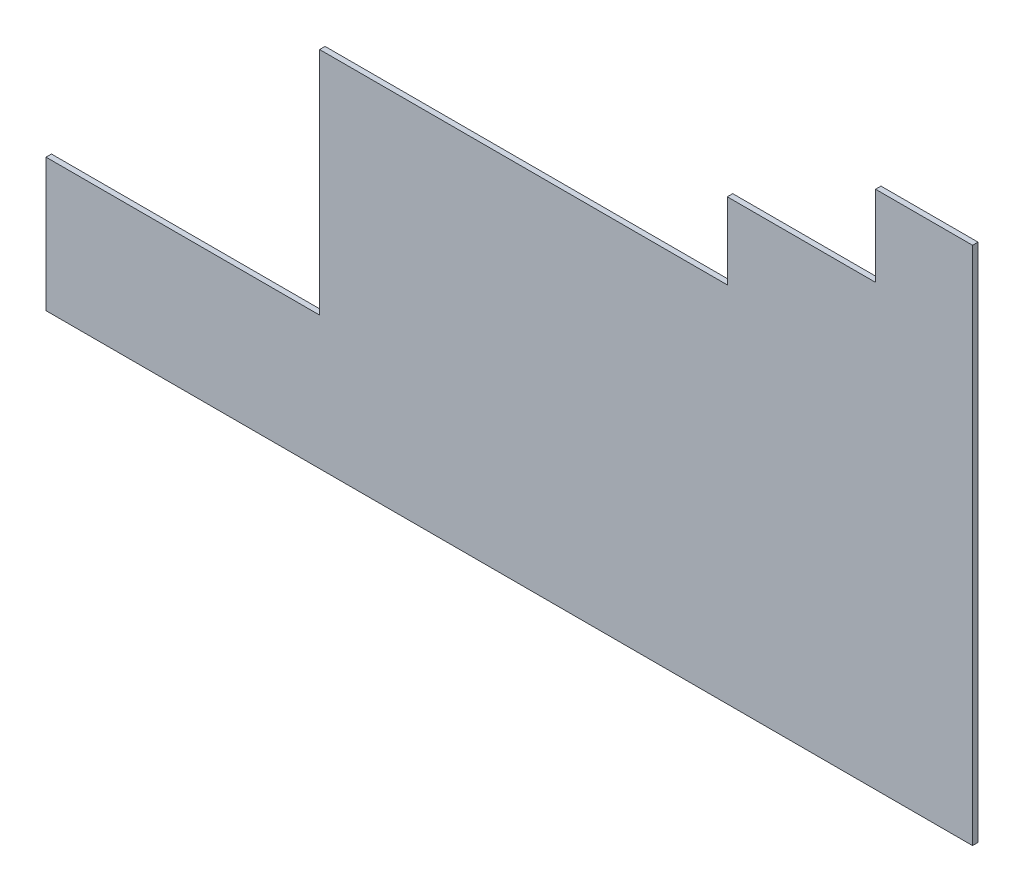
from build123d import *

# Parameters (mm, degrees)
TABAN_FLAN_1_DEPTH         = 25
KES_EKSTR_ZYON1_DEPTH      = 6508.676543898
KES_EKSTR_ZYON1_DEPTH_BACK = 6508.676543898
IZIM7_W                    = 1400
IZIM7_H                    = 1895
IZIM7_W_2                  = 310
IZIM7_H_2                  = 495
KES_EKSTR_ZYON2_DEPTH      = 6508.676543898
KES_EKSTR_ZYON2_DEPTH_BACK = 6508.676543898
IZIM8_W                    = 292
IZIM8_H                    = 2515
KES_EKSTR_ZYON3_DEPTH      = 6240.38698912
KES_EKSTR_ZYON3_DEPTH_BACK = 6240.38698912
IZIM10_W                   = 2900
IZIM10_H                   = 350
KES_EKSTR_ZYON4_DEPTH      = 6240.38698912
KES_EKSTR_ZYON4_DEPTH_BACK = 6240.38698912
KES_EKSTR_ZYON5_DEPTH      = 6191.05856192
KES_EKSTR_ZYON5_DEPTH_BACK = 6191.05856192
IZIM12_W                   = 5
IZIM12_H                   = 615
KES_EKSTR_ZYON6_DEPTH      = 6191.05856192
KES_EKSTR_ZYON6_DEPTH_BACK = 6191.05856192
IZIM13_W                   = 55
IZIM13_H                   = 2385


# Sheet-metal steps are written as plain solids
with BuildPart() as part:
    # Çizim1 → Taban-Flanş1 (new body)
    with BuildSketch(Plane.XY):
        Polygon((0, 0), (0, 1895), (2935, 1895), (2935, 2020), (4900, 2020), (4900, 2515), (6002, 2515), (6002, 0), align=None)
    extrude(amount=-TABAN_FLAN_1_DEPTH)

    # Çizim7 → Kes-Ekstrüzyon1 (cut, two sides: drawn at the far end of the back side and taken through both)
    with BuildSketch(Plane.XY.offset(-KES_EKSTR_ZYON1_DEPTH_BACK)):
        with Locations((700, 947.5)):
            Rectangle(IZIM7_W, IZIM7_H)
        with Locations((5055, 2267.5)):
            Rectangle(IZIM7_W_2, IZIM7_H_2)
    extrude(amount=KES_EKSTR_ZYON1_DEPTH + KES_EKSTR_ZYON1_DEPTH_BACK, mode=Mode.SUBTRACT)

    # Çizim8 → Kes-Ekstrüzyon2 (cut, two sides: drawn at the far end of the back side and taken through both)
    with BuildSketch(Plane.XY.offset(-KES_EKSTR_ZYON2_DEPTH_BACK)):
        with Locations((5856, 1257.5)):
            Rectangle(IZIM8_W, IZIM8_H)
    extrude(amount=KES_EKSTR_ZYON2_DEPTH + KES_EKSTR_ZYON2_DEPTH_BACK, mode=Mode.SUBTRACT)

    # Çizim10 → Kes-Ekstrüzyon3 (cut, two sides: drawn at the far end of the back side and taken through both)
    with BuildSketch(Plane.XY.offset(-KES_EKSTR_ZYON3_DEPTH_BACK)):
        with Locations((2850, 1845)):
            Rectangle(IZIM10_W, IZIM10_H)
    extrude(amount=KES_EKSTR_ZYON3_DEPTH + KES_EKSTR_ZYON3_DEPTH_BACK, mode=Mode.SUBTRACT)

    # Çizim11 → Kes-Ekstrüzyon4 (cut, two sides: drawn at the far end of the back side and taken through both)
    with BuildSketch(Plane.XY.offset(-KES_EKSTR_ZYON4_DEPTH_BACK)):
        Polygon((4300, 1670), (4530, 1670), (4530, 2020), (5210, 2020), (5210, 2390), (5710, 2390), (5778.630385148, 2406.496682207), (5749.815338653, 2697.266696836), (5189.231706845, 2697.266696836), (4530, 2199.552257381), (4300, 2199.552257381), align=None)
    extrude(amount=KES_EKSTR_ZYON4_DEPTH + KES_EKSTR_ZYON4_DEPTH_BACK, mode=Mode.SUBTRACT)

    # Çizim12 → Kes-Ekstrüzyon5 (cut, two sides: drawn at the far end of the back side and taken through both)
    with BuildSketch(Plane.XY.offset(-KES_EKSTR_ZYON5_DEPTH_BACK)):
        Polygon((2660, 1670), (1400, 1670), (1400, 615), (1405, 615), (2660, 615), align=None)
        with Locations((1402.5, 307.5)):
            Rectangle(IZIM12_W, IZIM12_H)
    extrude(amount=KES_EKSTR_ZYON5_DEPTH + KES_EKSTR_ZYON5_DEPTH_BACK, mode=Mode.SUBTRACT)

    # Çizim13 → Kes-Ekstrüzyon6 (cut, two sides: drawn at the far end of the back side and taken through both)
    with BuildSketch(Plane.XY.offset(-KES_EKSTR_ZYON6_DEPTH_BACK)):
        with Locations((5682.5, 1197.5)):
            Rectangle(IZIM13_W, IZIM13_H)
        Polygon((1405, 0), (5710, 0), (5710, 5), (5655, 5), (1405, 5), align=None)
    extrude(amount=KES_EKSTR_ZYON6_DEPTH + KES_EKSTR_ZYON6_DEPTH_BACK, mode=Mode.SUBTRACT)


solid = part.part
